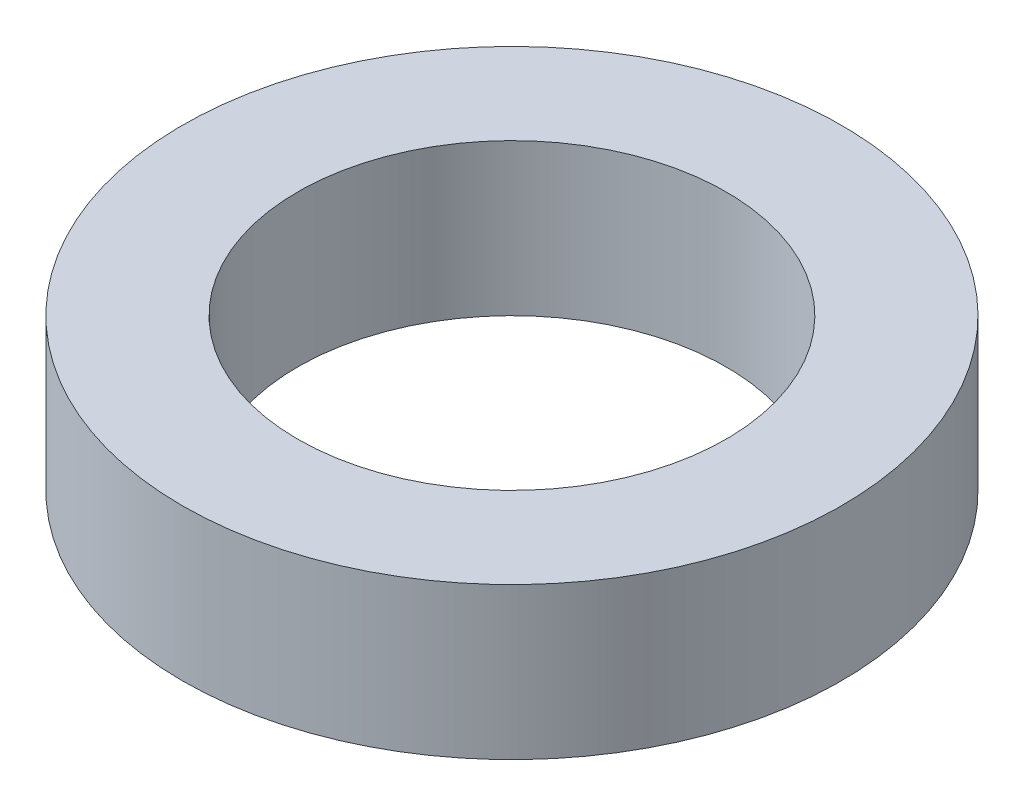
from build123d import *

# Parameters (mm, degrees)
SKETCH1_R           = 50
BOSS_EXTRUDE1_DEPTH = 23
SKETCH2_R           = 32.5
CUT_EXTRUDE1_DEPTH  = 75.35724578


with BuildPart() as part:
    # Sketch1 → Boss-Extrude1 (new body)
    with BuildSketch(Plane(origin=(0, 0, 0), x_dir=(1, 0, 0), z_dir=(0, 1, 0))):
        Circle(SKETCH1_R)
    extrude(amount=BOSS_EXTRUDE1_DEPTH)

    # Sketch2 → Cut-Extrude1 (cut, through all)
    with BuildSketch(Plane(origin=(0, 0, 0), x_dir=(1, 0, 0), z_dir=(0, 1, 0))):
        Circle(SKETCH2_R)
    extrude(amount=CUT_EXTRUDE1_DEPTH, mode=Mode.SUBTRACT)


solid = part.part
